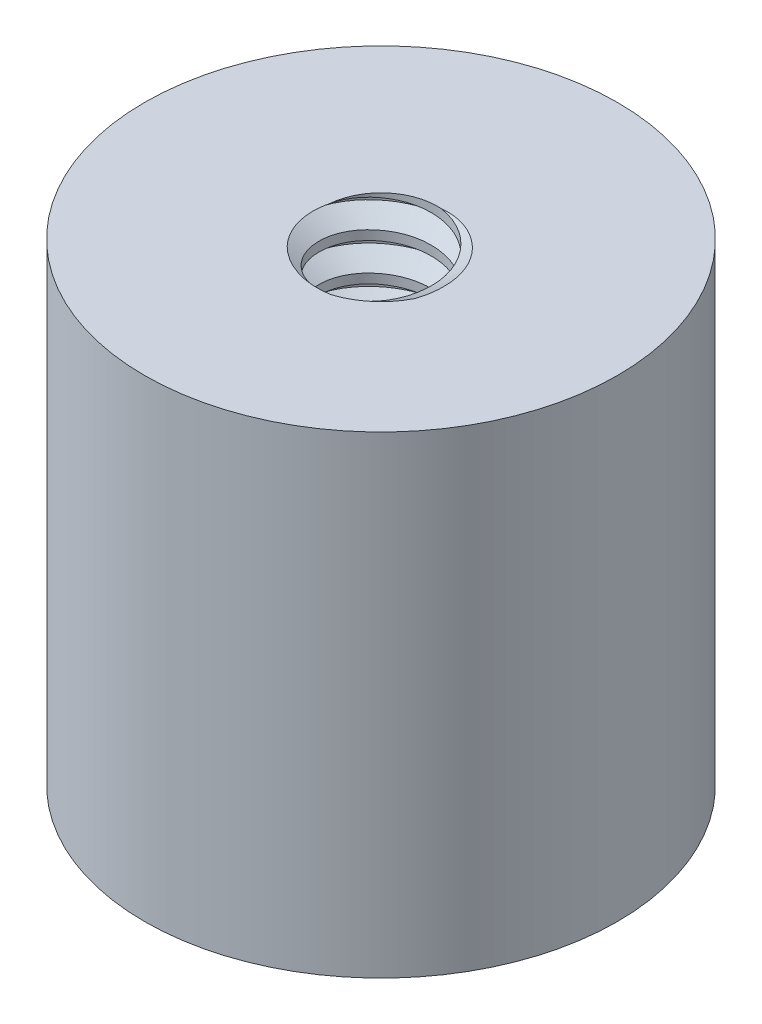
from build123d import *

# Parameters (mm, degrees)
SKETCH1_R           = 4
SKETCH1_R_2         = 1.3
BOSS_EXTRUDE1_DEPTH = 8
THREAD1_PITCH       = 0.635
SKETCH4_R           = 4
CUT_EXTRUDE1_DEPTH  = 8
CUT_EXTRUDE2_START  = 8
SKETCH5_R           = 4
CUT_EXTRUDE2_DEPTH  = 8


with BuildPart() as part:
    # Sketch1 → Boss-Extrude1 (new body)
    with BuildSketch(Plane(origin=(0, 0, 0), x_dir=(1, 0, 0), z_dir=(0, 1, 0))):
        with Locations(Location((0, 0, 0), (0, 0, 270))):
            Circle(SKETCH1_R)
        with Locations(Location((0, 0, 0), (0, 0, 270))):
            Circle(SKETCH1_R_2, mode=Mode.SUBTRACT)
    extrude(amount=BOSS_EXTRUDE1_DEPTH)

    # Thread1: the profile of Thread Profile1 profile screwed along a right-hand helix of 14.173228 turns, 6 arcs to a turn; built about Z, then put on its axis
    thread1_z = Axis((0, 0, 0), (0, 0, 1))
    thread1_corners = [(1.3003, 0, -0.000173205), (1.3003, 0, 0.555798203), (0.956296169, 0, 0.357187499), (0.956296169, 0, 0.198437499)]
    with BuildLine(mode=Mode.PRIVATE) as thread1_profile:
        Line(thread1_corners[0], thread1_corners[1])
        Line(thread1_corners[1], thread1_corners[2])
        Line(thread1_corners[2], thread1_corners[3])
        Line(thread1_corners[3], thread1_corners[0])
    thread1_cap = Face(thread1_profile.wire())
    thread1_turn_angles = [0, 30, 60, 90, 120, 150, 180, 210, 240, 270, 300, 330, 360]
    thread1_turn_weights = [1, 0.8660254037844387, 1, 0.8660254037844387, 1, 0.8660254037844387, 1, 0.8660254037844387, 1, 0.8660254037844387, 1, 0.8660254037844387, 1]
    thread1_turn_rails = [Edge.make_bspline([Vector(p[0], p[1], 0).rotate(thread1_z, thread1_turn_angles[k]) / thread1_turn_weights[k] + Vector(0, 0, p[2] + THREAD1_PITCH * thread1_turn_angles[k] / 360) for k in range(13)], [0, 0, 0, 1, 1, 2, 2, 3, 3, 4, 4, 5, 5, 6, 6, 6], 2, thread1_turn_weights) for p in thread1_corners]
    thread1_turn_sides = [Face.make_surface_from_curves(thread1_turn_rails[p[0]], thread1_turn_rails[p[1]]) for p in [(0, 1), (1, 2), (2, 3), (3, 0)]]
    thread1_last_angles = [5040, 5070, 5100, 5101.181102362, 5102.362204724]
    thread1_last_weights = [1, 0.8660254037844387, 1, 0.9997875364486429, 1]
    thread1_last_rails = [Edge.make_bspline([Vector(p[0], p[1], 0).rotate(thread1_z, thread1_last_angles[k]) / thread1_last_weights[k] + Vector(0, 0, p[2] + THREAD1_PITCH * thread1_last_angles[k] / 360) for k in range(5)], [0, 0, 0, 1, 1, 2, 2, 2], 2, thread1_last_weights) for p in thread1_corners]
    thread1_last_sides = [Face.make_surface_from_curves(thread1_last_rails[p[0]], thread1_last_rails[p[1]]) for p in [(0, 1), (1, 2), (2, 3), (3, 0)]]
    thread1 = Plane(origin=(0, 9, 0), x_dir=(-1, 0, 0), z_dir=(0, -1, 0)) * Solid(Shell([*[p.moved(Location((0, 0, THREAD1_PITCH * i))) for i in range(14) for p in thread1_turn_sides], *thread1_last_sides, thread1_cap, thread1_cap.rotate(thread1_z, 5102.362204724).moved(Location((0, 0, THREAD1_PITCH * 5102.362204724 / 360)))]))
    add(thread1)

    # Sketch4 → Cut-Extrude1 (cut)
    with BuildSketch(Plane(origin=(0, 8, 0), x_dir=(1, 0, 0), z_dir=(0, 1, 0))):
        with Locations(Location((0, 0, 0), (0, 0, 270))):
            Circle(SKETCH4_R)
    extrude(amount=CUT_EXTRUDE1_DEPTH, mode=Mode.SUBTRACT)

    # Sketch5 → Cut-Extrude2 (cut)
    with BuildSketch(Plane.XZ.offset(CUT_EXTRUDE2_START)):
        with Locations(Location((0, 0, 0), (0, 0, 90))):
            Circle(SKETCH5_R)
    extrude(amount=-CUT_EXTRUDE2_DEPTH, mode=Mode.SUBTRACT)


solid = part.part
